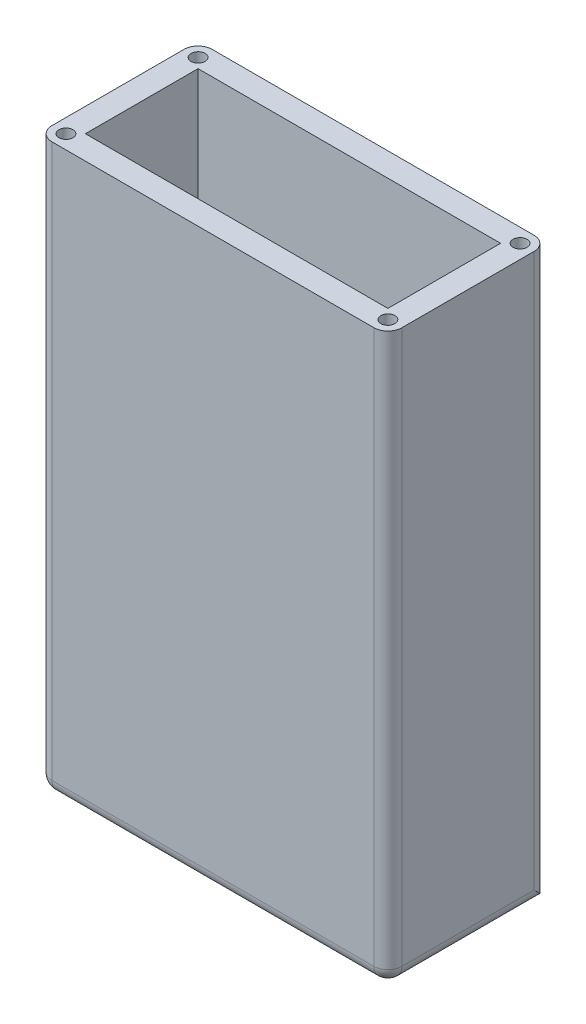
from build123d import *

# Parameters (mm, degrees)
SKETCH1_W           = 74.93
SKETCH1_H           = 34.29
BOSS_EXTRUDE1_DEPTH = 87.122
SHELL1_T            = -2.54
SKETCH12_W          = 74.93
SKETCH12_H          = 34.29
BOSS_EXTRUDE6_DEPTH = 34.29
SHELL2_T            = -5.08
CUT_EXTRUDE13_REACH = 123.777
SKETCH18_W          = 12.7
SKETCH18_H          = 9.525
SKETCH18_W_2        = 5
SKETCH18_H_2        = 10.13
SKETCH20_R          = 1.5
CUT_EXTRUDE14_DEPTH = 20
FILLET1_R           = 3


with BuildPart() as part:
    # Sketch1 → Boss-Extrude1 (new body)
    with BuildSketch(Plane(origin=(0, 0, 0), x_dir=(1, 0, 0), z_dir=(0, 1, 0))):
        with Locations((37.465, 17.145)):
            Rectangle(SKETCH1_W, SKETCH1_H)
    extrude(amount=BOSS_EXTRUDE1_DEPTH)

    # Shell1
    shell1_openings = [part.faces().sort_by_distance(p)[0] for p in [
        (37.465, 43.561, -34.29),
    ]]
    offset(amount=SHELL1_T, openings=shell1_openings, kind=Kind.INTERSECTION)

    # Sketch12 → Boss-Extrude6 (add)
    with BuildSketch(Plane(origin=(0, 87.122, 0), x_dir=(1, 0, 0), z_dir=(0, 1, 0))):
        with Locations((37.465, 17.145)):
            Rectangle(SKETCH12_W, SKETCH12_H)
    extrude(amount=BOSS_EXTRUDE6_DEPTH)

    # Shell2
    shell2_openings = [part.faces().sort_by_distance(p)[0] for p in [
        (37.465, 121.412, -17.145),
    ]]
    offset(amount=SHELL2_T, openings=shell2_openings)

    # Sketch18 → Cut-Extrude13 (cut, up to next)
    with BuildSketch(Plane(origin=(0, 89.662, 0), x_dir=(1, 0, 0), z_dir=(0, 1, 0)), mode=Mode.PRIVATE) as cut_extrude13_sk1:
        with Locations((28.575, 9.8425)):
            Rectangle(SKETCH18_W, SKETCH18_H)
    cut_extrude13_tool1 = extrude(cut_extrude13_sk1.sketch, amount=-CUT_EXTRUDE13_REACH, mode=Mode.PRIVATE) & part.part
    # Sketch18 → Cut-Extrude13 (cut, up to next)
    with BuildSketch(Plane(origin=(0, 89.662, 0), x_dir=(1, 0, 0), z_dir=(0, 1, 0)), mode=Mode.PRIVATE) as cut_extrude13_sk2:
        with Locations((67.35, 17.145)):
            Rectangle(SKETCH18_W_2, SKETCH18_H_2)
    cut_extrude13_tool2 = extrude(cut_extrude13_sk2.sketch, amount=-CUT_EXTRUDE13_REACH, mode=Mode.PRIVATE) & part.part
    add(cut_extrude13_tool1.solids().sort_by_distance((28.575, 89.662, -9.8425))[0], mode=Mode.SUBTRACT)
    add(cut_extrude13_tool2.solids().sort_by_distance((67.35, 89.662, -17.145))[0], mode=Mode.SUBTRACT)

    # Sketch20 → Cut-Extrude14 (cut)
    with BuildSketch(Plane(origin=(0, 121.412, 0), x_dir=(1, 0, 0), z_dir=(0, 1, 0))):
        with Locations(Location((3, 31.29, 0), (0, 0, 270))):
            Circle(SKETCH20_R)
        with Locations(Location((3, 3, 0), (0, 0, 270))):
            Circle(SKETCH20_R)
        with Locations(Location((71.93, 3, 0), (0, 0, 270))):
            Circle(SKETCH20_R)
        with Locations(Location((71.93, 31.29, 0), (0, 0, 270))):
            Circle(SKETCH20_R)
    extrude(amount=-CUT_EXTRUDE14_DEPTH, mode=Mode.SUBTRACT)

    # Fillet1
    # the kernel refuses this fillet: 3 mm, written as the material it takes off along each edge
    with BuildSketch(Plane(origin=(71.93, 3, -3), x_dir=(1, 0, 0), z_dir=(0, 0, 1))) as fillet1_piece_1_section:
        Polygon((0, 0), (FILLET1_R, 0), (FILLET1_R, -FILLET1_R), (0, -FILLET1_R), align=None)
    fillet1_piece_1 = extrude(amount=FILLET1_R, mode=Mode.PRIVATE)
    fillet1_piece_1 = fillet1_piece_1 - Plane(origin=(71.93, 3, -3), x_dir=(-0.7071067811865475, 0.7071067811865475, 0), z_dir=(0, 0, 1)) * Sphere(FILLET1_R, mode=Mode.PRIVATE)
    add(fillet1_piece_1, mode=Mode.SUBTRACT)
    with BuildSketch(Plane(origin=(3, 3, -3), x_dir=(-1, 0, 0), z_dir=(0, 0, 1))) as fillet1_piece_2_section:
        Polygon((0, 0), (FILLET1_R, 0), (FILLET1_R, FILLET1_R), (0, FILLET1_R), align=None)
    fillet1_piece_2 = extrude(amount=FILLET1_R, mode=Mode.PRIVATE)
    fillet1_piece_2 = fillet1_piece_2 - Plane(origin=(3, 3, -3), x_dir=(0.7071067811865475, 0.7071067811865475, 0), z_dir=(0, 0, 1)) * Sphere(FILLET1_R, mode=Mode.PRIVATE)
    add(fillet1_piece_2, mode=Mode.SUBTRACT)
    with BuildSketch(Plane(origin=(74.93, 0, -3), x_dir=(0, 1, 0), z_dir=(0, 0, -1)), Plane(origin=(0, 0, -41.79), x_dir=(0, 1, 0), z_dir=(0, 0, 1))) as fillet1_piece_3:
        with BuildLine():
            CenterArc((FILLET1_R, -FILLET1_R), FILLET1_R, 90, 90)
            Line((0, -FILLET1_R), (0, 0))
            Line((0, 0), (FILLET1_R, 0))
        make_face()
    extrude(amount=38.79, mode=Mode.SUBTRACT)
    with BuildSketch(Plane(origin=(3, 0, 0), x_dir=(0, 1, 0), z_dir=(1, 0, 0))) as fillet1_piece_4:
        with BuildLine():
            CenterArc((FILLET1_R, -FILLET1_R), FILLET1_R, 90, 90)
            Line((0, -FILLET1_R), (0, 0))
            Line((0, 0), (FILLET1_R, 0))
        make_face()
    extrude(amount=68.93, mode=Mode.SUBTRACT)
    with BuildSketch(Plane(origin=(74.93, -7.5, -34.29), x_dir=(0, 0, 1), z_dir=(0, 1, 0)), Plane(origin=(0, 128.912, -34.29), x_dir=(0, 0, 1), z_dir=(0, -1, 0))) as fillet1_piece_5:
        with BuildLine():
            CenterArc((FILLET1_R, -FILLET1_R), FILLET1_R, 90, 90)
            Line((0, -FILLET1_R), (0, 0))
            Line((0, 0), (FILLET1_R, 0))
        make_face()
    extrude(amount=136.412, mode=Mode.SUBTRACT)
    with BuildSketch(Plane(origin=(74.93, 3, 0), x_dir=(-1, 0, 0), z_dir=(0, 1, 0)), Plane(origin=(0, 128.912, 0), x_dir=(1, 0, 0), z_dir=(0, -1, 0))) as fillet1_piece_6:
        with BuildLine():
            CenterArc((FILLET1_R, -FILLET1_R), FILLET1_R, 90, 90)
            Line((0, -FILLET1_R), (0, 0))
            Line((0, 0), (FILLET1_R, 0))
        make_face()
    extrude(amount=125.912, mode=Mode.SUBTRACT)


solid = part.part
